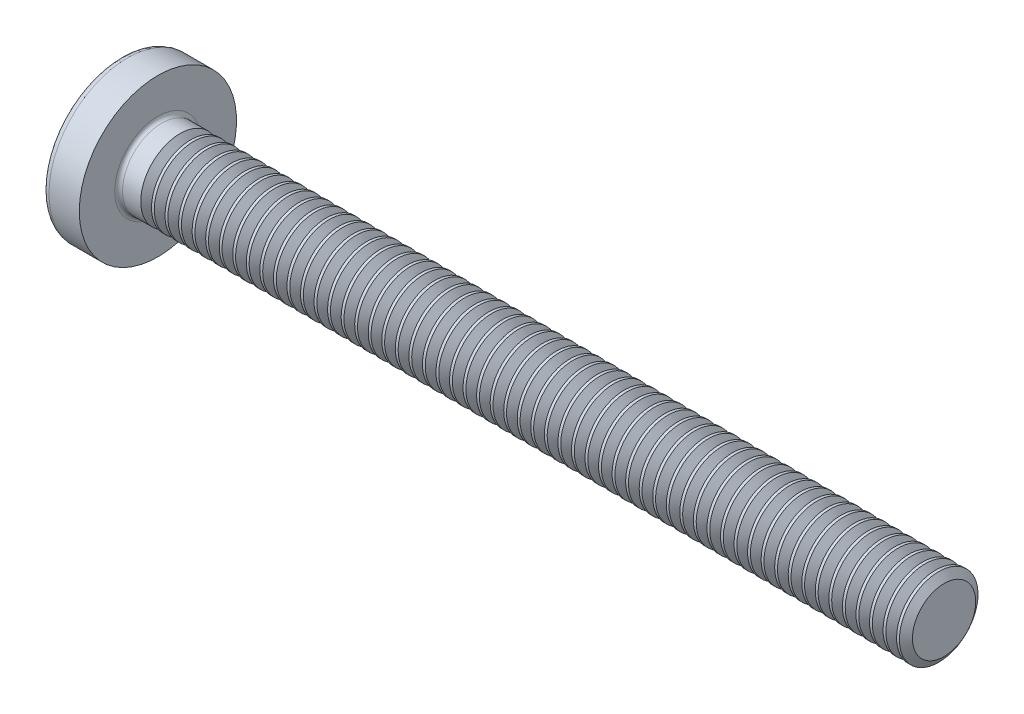
from build123d import *

# Parameters (mm, degrees)
RECPAT_COUNT    = 2
RECPAT_ANGLE    = 90
THDSCHPAT_COUNT = 57
THDSCHPAT_PITCH = 0.689285714


with BuildPart() as part:
    # Fillet1: read off the stored shape, not the designer's step
    # Fillet1 outline → Fillet1 (revolve)
    with BuildSketch(Plane.YX):
        with BuildLine():
            Line((2, 3.3), (2, 43.1))
            Line((2, 43.1), (0, 43.1))
            Line((0, 43.1), (0, 0))
            ThreePointArc((0, 0), (2.027933458, 0.324444488), (3.853420198, 1.265388956))
            ThreePointArc((3.853420198, 1.265388956), (3.961271902, 1.392873227), (4, 1.555305874))
            Line((4, 1.555305874), (4, 3.1))
            Line((4, 3.1), (2.2, 3.1))
            ThreePointArc((2.2, 3.1), (2.058578644, 3.158578644), (2, 3.3))
        make_face()
    revolve(axis=Axis((0, 0, 0), (1, 0, 0)))

    # Sketch3 → Recess section 0
    with BuildSketch(Plane(origin=(0, 0, 0), x_dir=(0, 0, -1), z_dir=(1, 0, 0))):
        with BuildLine():
            Line((0.515, -2.15), (-0.515, -2.15))
            Line((-0.515, -2.15), (-0.515, 2.15))
            Line((-0.515, 2.15), (0.515, 2.15))
            Line((0.515, 2.15), (0.515, -2.15))
        make_face()
    # Sketch4 → Recess section 1
    with BuildSketch(Plane(origin=(2.34, 0, 0), x_dir=(0, 0, -1), z_dir=(1, 0, 0))):
        with BuildLine():
            Line((0.515, -0.983319232), (-0.515, -0.983319232))
            Line((-0.515, -0.983319232), (-0.515, 0.983319232))
            Line((-0.515, 0.983319232), (0.515, 0.983319232))
            Line((0.515, 0.983319232), (0.515, -0.983319232))
        make_face()
    recess = loft(mode=Mode.SUBTRACT)

    # RecPat: Recess ×2 about axis
    recpat_axis = Axis((0, 0, 0), (1, 0, 0))
    for i in range(1, RECPAT_COUNT):
        add(recess.rotate(recpat_axis, i * RECPAT_ANGLE / (RECPAT_COUNT - 1)), mode=Mode.SUBTRACT)

    # RecCorSke → RecessCore (revolve, cut)
    with BuildSketch(Plane.XY, mode=Mode.PRIVATE) as recesscore_sk:
        Polygon((0, 0), (0, 1.01462874), (2.34, 0.851), (2.616506661, 0), align=None)
    revolve(recesscore_sk.sketch.rotate(Axis((-3.175, 0, 0), (1, 0, 0)), 90), axis=Axis((-3.175, 0, 0), (1, 0, 0)), mode=Mode.SUBTRACT)

    # ThdSchSke → ThreadSchematic (revolve, cut)
    with BuildSketch(Plane.XY, mode=Mode.PRIVATE) as threadschematic_sk:
        Polygon((4.5, -1.61), (4.22691906, -2), (4.22691906, -2.5), (4.77308094, -2.5), (4.77308094, -2), align=None)
    threadschematic = revolve(threadschematic_sk.sketch.rotate(Axis((-3.175, 0, 0), (1, 0, 0)), 270), axis=Axis((-3.175, 0, 0), (1, 0, 0)), mode=Mode.SUBTRACT)

    # ThdSchPat: ThreadSchematic ×57
    with Locations(*[(i * THDSCHPAT_PITCH, 0, 0) for i in range(1, THDSCHPAT_COUNT)]):
        add(threadschematic, mode=Mode.SUBTRACT)


solid = part.part
